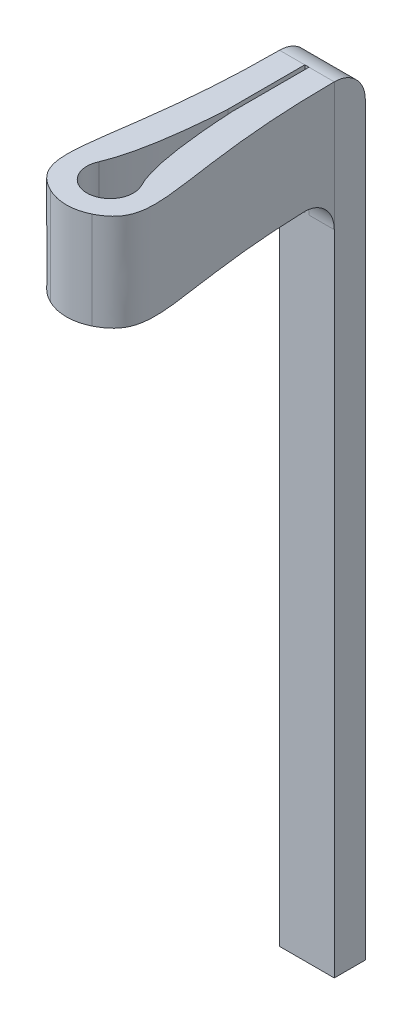
from build123d import *

# Parameters (mm, degrees)
BOSS_EXTRUDE1_DEPTH      = 1.5875
BOSS_EXTRUDE1_DEPTH_BACK = 1.5875
FILLET1_R                = 1.524
BOSS_EXTRUDE2_DEPTH      = 0.89581
BOSS_EXTRUDE2_DEPTH_BACK = 0.89581
FILLET2_R                = 1.016


with BuildPart() as part:
    # Sketch1 → Boss-Extrude1 (new, two sides: drawn at the far end of the back side and taken through both)
    with BuildSketch(Plane(origin=(0, 0, 0), x_dir=(1, 0, 0), z_dir=(0, 1, 0)).offset(-BOSS_EXTRUDE1_DEPTH_BACK)):
        with BuildLine():
            Line((-0.068296764, 6.214618695), (-0.068296764, 8.723993601))
            Line((-0.068296764, 8.723993601), (-0.895808533, 8.723993601))
            add(Edge.make_bspline(
                [(-0.895808533, 8.723993601), (-0.895808533, 4.54222596), (-1.588668774, 2.219313027), (-2.088196173, 1.337696034), (0, 0.766240154)],
                knots=[0, 0, 0, 0, 0, 1, 1, 1, 1, 1], degree=4))
            add(Edge.make_bspline(
                [(0.895808533, 8.723993601), (0.895808533, 4.54222596), (1.588668774, 2.219313027), (2.088196173, 1.337696034), (0, 0.766240154)],
                knots=[0, 0, 0, 0, 0, 1, 1, 1, 1, 1], degree=4))
            Line((0.895808533, 8.723993601), (0.068296764, 8.723993601))
            Line((0.068296764, 8.723993601), (0.068296764, 6.214618695))
            add(Edge.make_bspline(
                [(0.690807422, 2.606475487), (0.218071276, 3.482132924), (0.068296764, 6.214618695)],
                knots=[0, 0, 0, 1, 1, 1], degree=2))
            ThreePointArc((0.690807422, 2.606475487), (0, 1.52287153), (-0.690807422, 2.606475487))
            add(Edge.make_bspline(
                [(-0.690807422, 2.606475487), (-0.217222133, 3.738734236), (-0.068296764, 6.214618695)],
                knots=[0, 0, 0, 1, 1, 1], degree=2))
        make_face()
    extrude(amount=BOSS_EXTRUDE1_DEPTH + BOSS_EXTRUDE1_DEPTH_BACK)

    # Fillet1
    fillet1_edges = [part.edges().sort_by_distance(p)[0] for p in [
        (0, -0.79375, -0.766240154),
    ]]
    fillet(fillet1_edges, radius=FILLET1_R)

    # Sketch2 → Boss-Extrude2 (add, two sides: drawn at the far end of the back side and taken through both)
    with BuildSketch(Plane(origin=(0, 0, 0), x_dir=(0, 0, -1), z_dir=(1, 0, 0)).offset(-BOSS_EXTRUDE2_DEPTH_BACK)):
        Polygon((8.723993601, 1.5875), (8.723993601, -1.5875), (8.723993601, -23.8125), (9.739993601, -23.8125), (9.739993601, 1.5875), align=None)
    extrude(amount=BOSS_EXTRUDE2_DEPTH + BOSS_EXTRUDE2_DEPTH_BACK)

    # Fillet2
    fillet2_edges = [part.edges().sort_by_distance(p)[0] for p in [
        (0, 1.5875, -9.739993601),
        (0.482052648, -1.5875, -8.723993601),
        (-0.482052648, -1.5875, -8.723993601),
    ]]
    fillet(fillet2_edges, radius=FILLET2_R - 0.0001)  # a hair under: the kernel refuses the full size


solid = part.part
